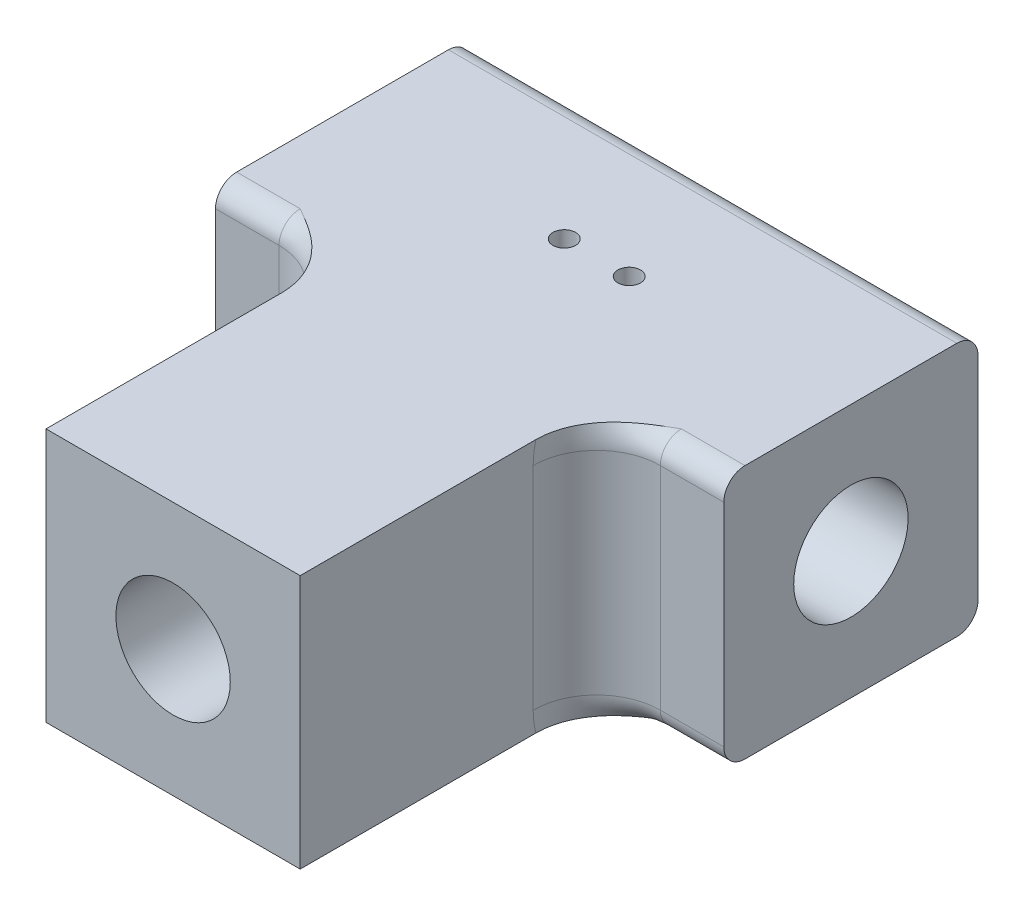
from build123d import *

# Parameters (mm, degrees)
SKETCH1_W                   = 12
SKETCH1_H                   = 6
BOSS_EXTRUDE1_DEPTH         = 6
F_75_0_021_DIAMETER_HOLE1_D = 0.5334
SKETCH15_W                  = 6
SKETCH15_H                  = 6
BOSS_EXTRUDE2_DEPTH         = 7
FILLET4_R                   = 0.5
FILLET3_R                   = 1.5
SKETCH19_R                  = 1.35
CUT_EXTRUDE1_DEPTH          = 5.5
SKETCH16_R                  = 1.35
CUT_EXTRUDE2_DEPTH          = 5


with BuildPart() as part:
    # Sketch1 → Boss-Extrude1 (new body)
    with BuildSketch(Plane(origin=(0, 0, 0), x_dir=(1, 0, 0), z_dir=(0, 1, 0))):
        Rectangle(SKETCH1_W, SKETCH1_H)
    extrude(amount=BOSS_EXTRUDE1_DEPTH)

    # #75 (0.021) Diameter Hole1 (through all)
    with Locations(Plane(origin=(0, 6, 0), x_dir=(1, 0, 0), z_dir=(0, 1, 0))):
        with Locations((0.7667, 0), (-0.7667, 0)):
            Hole(F_75_0_021_DIAMETER_HOLE1_D / 2)

    # Sketch15 → Boss-Extrude2 (add)
    with BuildSketch(Plane.XY.offset(3)):
        with Locations((0, 3)):
            Rectangle(SKETCH15_W, SKETCH15_H)
    extrude(amount=BOSS_EXTRUDE2_DEPTH)

    # Fillet4
    fillet4_edges = [part.edges().sort_by_distance(p)[0] for p in [
        (4.5, 6, 3),
        (4.5, 0, 3),
        (-4.5, 0, 3),
        (0, 0, -3),
        (0, 6, -3),
        (-4.5, 6, 3),
    ]]
    fillet(fillet4_edges, radius=FILLET4_R)

    # Fillet3
    fillet3_edges = [part.edges().sort_by_distance(p)[0] for p in [
        (-3, 3, 3),
        (-3, 0.146446609, 2.853553391),
        (-3, 5.853553391, 2.853553391),
    ]]
    fillet(fillet3_edges, radius=FILLET3_R)
    fillet3_2_edges = [part.edges().sort_by_distance(p)[0] for p in [
        (3, 5.853553391, 2.853553391),
        (3, 3, 3),
        (3, 0.146446609, 2.853553391),
    ]]
    fillet(fillet3_2_edges, radius=FILLET3_R)

    # Sketch19 → Cut-Extrude1 (cut)
    with BuildSketch(Plane.ZY.offset(6)):
        with Locations((0, 3)):
            Circle(SKETCH19_R)
    cut_extrude1 = extrude(amount=-CUT_EXTRUDE1_DEPTH, mode=Mode.SUBTRACT)

    # Sketch16 → Cut-Extrude2 (cut)
    with BuildSketch(Plane.XY.offset(10)):
        with Locations((0, 3)):
            Circle(SKETCH16_R)
    extrude(amount=-CUT_EXTRUDE2_DEPTH, mode=Mode.SUBTRACT)

    # Mirror2: Cut-Extrude1 across plane
    add(cut_extrude1.mirror(Plane(origin=(0, 0, 0), x_dir=(0, 0, 1), z_dir=(1, 0, 0))), mode=Mode.SUBTRACT)


solid = part.part
